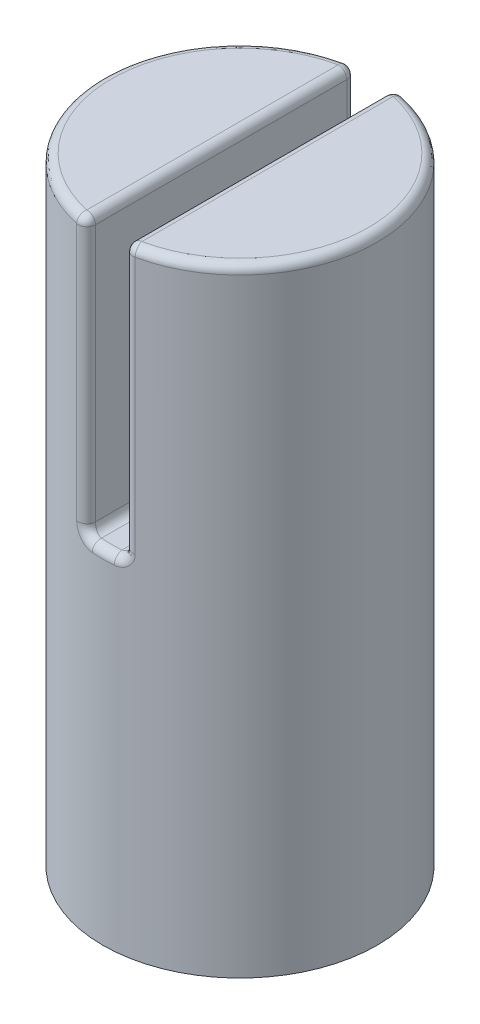
from build123d import *

# Parameters (mm, degrees)
SKETCH1_R           = 4
BOSS_EXTRUDE1_DEPTH = 7
SKETCH3_R           = 4
BOSS_EXTRUDE3_DEPTH = 11
CHAMFER1_SIZE       = 0.5
CUT_EXTRUDE1_DEPTH  = 8
FILLET1_R           = 0.25


with BuildPart() as part:
    # Sketch1 → Boss-Extrude1 (new body)
    with BuildSketch(Plane(origin=(0, 0, 0), x_dir=(1, 0, 0), z_dir=(0, 1, 0))):
        with Locations((0.002736267, 0)):
            Circle(SKETCH1_R)
        with BuildLine():
            Line((1.802736267, 2.2737634), (1.802736267, -2.2737634))
            ThreePointArc((1.802736267, -2.2737634), (0.002736267, -2.9), (-1.797263733, -2.2737634))
            Line((-1.797263733, -2.2737634), (-1.797263733, 2.2737634))
            ThreePointArc((-1.797263733, 2.2737634), (0.002736267, 2.9), (1.802736267, 2.2737634))
        make_face(mode=Mode.SUBTRACT)
    extrude(amount=BOSS_EXTRUDE1_DEPTH)

    # Sketch3 → Boss-Extrude3 (add)
    with BuildSketch(Plane(origin=(0, 7, 0), x_dir=(1, 0, 0), z_dir=(0, 1, 0))):
        with Locations((0.002736267, 0)):
            Circle(SKETCH3_R)
    extrude(amount=BOSS_EXTRUDE3_DEPTH)

    # Chamfer1
    chamfer1_edges = [part.edges().sort_by_distance(p)[0] for p in [
        (-1.797263733, 0, 0),
        (0.002736267, 0, -2.9),
        (0.002736267, 0, 2.9),
        (1.802736267, 0, 0),
    ]]
    chamfer(chamfer1_edges, length=CHAMFER1_SIZE)

    # Sketch5 → Cut-Extrude1 (cut)
    with BuildSketch(Plane(origin=(0, 18, 0), x_dir=(1, 0, 0), z_dir=(0, 1, 0))):
        with BuildLine():
            Line((0.552736267, 4.365489663), (0.552736267, -4.365489663))
            ThreePointArc((0.552736267, -4.365489663), (0.002736267, -4.4), (-0.547263733, -4.365489663))
            Line((-0.547263733, -4.365489663), (-0.547263733, 4.365489663))
            ThreePointArc((-0.547263733, 4.365489663), (0.002736267, 4.4), (0.552736267, 4.365489663))
        make_face()
    extrude(amount=-CUT_EXTRUDE1_DEPTH, mode=Mode.SUBTRACT)

    # Fillet1
    fillet1_edges = [part.edges().sort_by_distance(p)[0] for p in [
        (0.552736267, 14, 3.962007067),
        (0.552736267, 14, -3.962007067),
        (-0.547263733, 14, 3.962007067),
        (-0.547263733, 14, -3.962007067),
        (0.552736267, 10, 0),
        (0.002736267, 10, 4),
        (-0.547263733, 10, 0),
        (0.002736267, 10, -4),
        (3.019356893, 18, 2.626785107),
        (0.552736267, 18, 0),
        (-3.997263733, 18, 0),
        (-0.547263733, 18, 0),
    ]]
    fillet(fillet1_edges, radius=FILLET1_R)


solid = part.part
